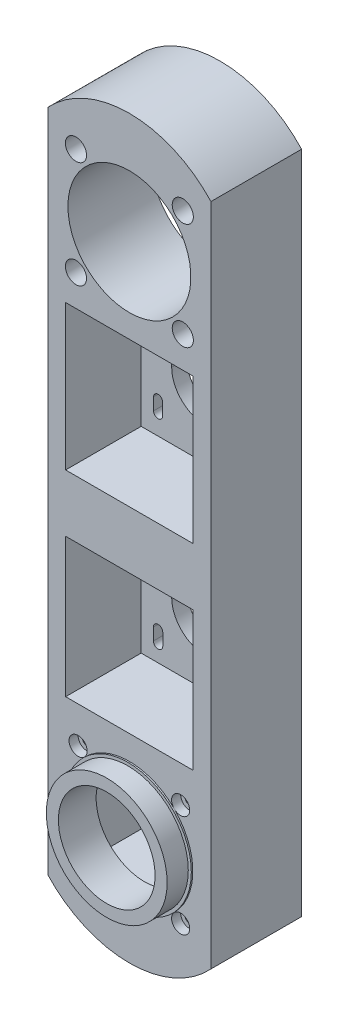
from build123d import *

# Parameters (mm, degrees)
SKETCH_1_W                = 54
SKETCH_1_H                = 220
EXTRUDE_1_DEPTH           = 30
SKETCH_2_W                = 42.2
SKETCH_2_H                = 48
CUT_EXTRUDE_1_DEPTH       = 25
SKETCH_3_W                = 42.2
SKETCH_3_H                = 46
CUT_EXTRUDE_2_DEPTH       = 25
CUT_EXTRUDE_3_DEPTH       = 116.99137899
CUT_EXTRUDE_13_DEPTH      = 116.99137899
SKETCH_18_W               = 42
SKETCH_18_H               = 42.7
CUT_EXTRUDE_9_DEPTH       = 25
SKETCH_9_R                = 16
SKETCH_9_R_2              = 1.55
CUT_EXTRUDE_4_DEPTH       = 116.99137899
SKETCH_16_W               = 42.7
SKETCH_16_H               = 42.7
CUT_EXTRUDE_7_DEPTH       = 2.5
SKETCH_13_R               = 20.35
SKETCH_13_R_2             = 2.05
CUT_EXTRUDE_6_DEPTH       = 117.555780637
EXTRUDE_3_DEPTH           = 30
SKETCH_17_R               = 2.05
CUT_EXTRUDE_8_DEPTH       = 8
CUT_EXTRUDE_11_DEPTH      = 129.309959191
CUT_EXTRUDE_11_DEPTH_BACK = 7.5
SKETCH_21_R               = 3.5
EXTRUDE_4_DEPTH           = 30
SKETCH_29_R               = 3
CUT_EXTRUDE_15_DEPTH      = 3
SKETCH_30_R               = 2.05
CUT_EXTRUDE_16_DEPTH      = 8
SKETCH_33_R               = 20
SKETCH_33_R_2             = 16
EXTRUDE_7_DEPTH           = 7.5
SKETCH_34_R               = 21
SKETCH_34_R_2             = 20
EXTRUDE_8_DEPTH           = 0.5


with BuildPart() as part:
    # 草图1 → 凸台-拉伸1 (new body)
    with BuildSketch(Plane.XY):
        Rectangle(SKETCH_1_W, SKETCH_1_H)
    extrude(amount=EXTRUDE_1_DEPTH)

    # 草图2 → 切除-拉伸1 (cut)
    with BuildSketch(Plane.XY.offset(30)):
        with Locations((0, 33)):
            Rectangle(SKETCH_2_W, SKETCH_2_H)
    extrude(amount=-CUT_EXTRUDE_1_DEPTH, mode=Mode.SUBTRACT)

    # 草图3 → 切除-拉伸2 (cut)
    with BuildSketch(Plane(origin=(0, 0, 30), x_dir=(-1, 0, 0), z_dir=(0, 0, -1))):
        with Locations((0, -33)):
            Rectangle(SKETCH_3_W, SKETCH_3_H)
    extrude(amount=CUT_EXTRUDE_2_DEPTH, mode=Mode.SUBTRACT)

    # 草图4 → 切除-拉伸3 (cut, through all)
    with BuildSketch(Plane.XY.offset(5)):
        with BuildLine():
            Line((11, 31), (11, 35))
            ThreePointArc((11, 35), (0, 46), (-11, 35))
            Line((-11, 35), (-11, 31))
            ThreePointArc((-11, 31), (0, 20), (11, 31))
        make_face()
        with BuildLine():
            Line((-14, 46.5), (-14, 50.5))
            ThreePointArc((-14, 50.5), (-15.5, 52), (-17, 50.5))
            Line((-17, 50.5), (-17, 46.5))
            ThreePointArc((-17, 46.5), (-15.5, 45), (-14, 46.5))
        make_face()
        with BuildLine():
            ThreePointArc((17, 50.5), (15.5, 52), (14, 50.5))
            Line((14, 50.5), (14, 46.5))
            ThreePointArc((14, 46.5), (15.5, 45), (17, 46.5))
            Line((17, 46.5), (17, 50.5))
        make_face()
        with BuildLine():
            Line((14, 19.5), (14, 15.5))
            ThreePointArc((14, 15.5), (15.5, 14), (17, 15.5))
            Line((17, 15.5), (17, 19.5))
            ThreePointArc((17, 19.5), (15.5, 21), (14, 19.5))
        make_face()
        with BuildLine():
            ThreePointArc((-17, 15.5), (-15.5, 14), (-14, 15.5))
            Line((-14, 15.5), (-14, 19.5))
            ThreePointArc((-14, 19.5), (-15.5, 21), (-17, 19.5))
            Line((-17, 19.5), (-17, 15.5))
        make_face()
    extrude(amount=-CUT_EXTRUDE_3_DEPTH, mode=Mode.SUBTRACT)

    # 草图26 → 切除-拉伸13 (cut, through all)
    with BuildSketch(Plane.XY.offset(5)):
        with BuildLine():
            Line((11, -31), (11, -35))
            ThreePointArc((11, -35), (0, -46), (-11, -35))
            Line((-11, -35), (-11, -31))
            ThreePointArc((-11, -31), (0, -20), (11, -31))
        make_face()
        with BuildLine():
            Line((-13.95, -15.5), (-13.95, -19.5))
            ThreePointArc((-13.95, -19.5), (-15.5, -21.05), (-17.05, -19.5))
            Line((-17.05, -19.5), (-17.05, -15.5))
            ThreePointArc((-17.05, -15.5), (-15.5, -13.95), (-13.95, -15.5))
        make_face()
        with BuildLine():
            Line((-13.95, -50.5), (-13.95, -46.5))
            ThreePointArc((-13.95, -46.5), (-15.5, -44.95), (-17.05, -46.5))
            Line((-17.05, -46.5), (-17.05, -50.5))
            ThreePointArc((-17.05, -50.5), (-15.5, -52.05), (-13.95, -50.5))
        make_face()
        with BuildLine():
            Line((13.95, -50.5), (13.95, -46.5))
            ThreePointArc((13.95, -46.5), (15.5, -44.95), (17.05, -46.5))
            Line((17.05, -46.5), (17.05, -50.5))
            ThreePointArc((17.05, -50.5), (15.5, -52.05), (13.95, -50.5))
        make_face()
        with BuildLine():
            Line((13.95, -15.5), (13.95, -19.5))
            ThreePointArc((13.95, -19.5), (15.5, -21.05), (17.05, -19.5))
            Line((17.05, -19.5), (17.05, -15.5))
            ThreePointArc((17.05, -15.5), (15.5, -13.95), (13.95, -15.5))
        make_face()
    extrude(amount=-CUT_EXTRUDE_13_DEPTH, mode=Mode.SUBTRACT)

    # 草图18 → 切除-拉伸9 (cut)
    with BuildSketch(Plane.XY):
        with Locations((0, -85)):
            Rectangle(SKETCH_18_W, SKETCH_18_H)
    extrude(amount=CUT_EXTRUDE_9_DEPTH, mode=Mode.SUBTRACT)

    # 草图9 → 切除-拉伸4 (cut, through all)
    with BuildSketch(Plane.XY.offset(25)):
        with Locations((0, -85)):
            Circle(SKETCH_9_R)
        with Locations((-16.970562748, -68.029437252)):
            Circle(SKETCH_9_R_2)
        with Locations((16.970562748, -68.029437252)):
            Circle(SKETCH_9_R_2)
        with Locations((16.970562748, -101.970562748)):
            Circle(SKETCH_9_R_2)
        with Locations((-16.970562748, -101.970562748)):
            Circle(SKETCH_9_R_2)
    extrude(amount=CUT_EXTRUDE_4_DEPTH, mode=Mode.SUBTRACT)

    # 草图16 → 切除-拉伸7 (cut)
    with BuildSketch(Plane.XY):
        with Locations((0, 85)):
            Rectangle(SKETCH_16_W, SKETCH_16_H)
    extrude(amount=CUT_EXTRUDE_7_DEPTH, mode=Mode.SUBTRACT)

    # 草图13 → 切除-拉伸6 (cut, through all)
    with BuildSketch(Plane(origin=(0, 0, 2.5), x_dir=(-1, 0, 0), z_dir=(0, 0, -1))):
        with Locations((0, 85)):
            Circle(SKETCH_13_R)
        with Locations((-17.67766953, 102.67766953)):
            Circle(SKETCH_13_R_2)
        with Locations((17.67766953, 102.67766953)):
            Circle(SKETCH_13_R_2)
        with Locations((17.67766953, 67.32233047)):
            Circle(SKETCH_13_R_2)
        with Locations((-17.67766953, 67.32233047)):
            Circle(SKETCH_13_R_2)
    extrude(amount=-CUT_EXTRUDE_6_DEPTH, mode=Mode.SUBTRACT)

    # 草图15 → 凸台-拉伸3 (add)
    with BuildSketch(Plane(origin=(0, 0, 0), x_dir=(-1, 0, 0), z_dir=(0, 0, -1))):
        with BuildLine():
            Line((-27, 110), (27, 110))
            ThreePointArc((27, 110), (0, 121.796738986), (-27, 110))
        make_face()
    extrude(amount=-EXTRUDE_3_DEPTH)

    # 草图17 → 切除-拉伸8 (cut)
    with BuildSketch(Plane(origin=(0, 0, 0), x_dir=(-1, 0, 0), z_dir=(0, 0, -1))):
        with Locations((-24, 100)):
            Circle(SKETCH_17_R)
        with Locations((24, 100)):
            Circle(SKETCH_17_R)
        with Locations((24, 66)):
            Circle(SKETCH_17_R)
        with Locations((-24, 66)):
            Circle(SKETCH_17_R)
    extrude(amount=-CUT_EXTRUDE_8_DEPTH, mode=Mode.SUBTRACT)

    # 草图21 → 切除-拉伸11 (cut, two sides: drawn at the far end of the back side and taken through both)
    with BuildSketch(Plane.XY.offset(30).offset(-CUT_EXTRUDE_11_DEPTH_BACK)):
        with Locations(Location((-17.67766953, 102.67766953, 0), (0, 0, 180))):
            Circle(SKETCH_21_R)
        with Locations(Location((17.67766953, 102.67766953, 0), (0, 0, 180))):
            Circle(SKETCH_21_R)
        with Locations(Location((17.67766953, 67.32233047, 0), (0, 0, 180))):
            Circle(SKETCH_21_R)
        with Locations(Location((-17.67766953, 67.32233047, 0), (0, 0, 180))):
            Circle(SKETCH_21_R)
    extrude(amount=CUT_EXTRUDE_11_DEPTH + CUT_EXTRUDE_11_DEPTH_BACK, mode=Mode.SUBTRACT)

    # 草图28 → 凸台-拉伸4 (add)
    with BuildSketch(Plane.XY.offset(30)):
        with BuildLine():
            Line((-27, -110), (27, -110))
            ThreePointArc((27, -110), (0, -121.795200461), (-27, -110))
        make_face()
    extrude(amount=-EXTRUDE_4_DEPTH)

    # 草图29 → 切除-拉伸15 (cut)
    with BuildSketch(Plane.XY.offset(30)):
        with Locations((-16.970562748, -68.029437252)):
            Circle(SKETCH_29_R)
        with Locations((16.970562748, -68.029437252)):
            Circle(SKETCH_29_R)
        with Locations((16.970562748, -101.970562748)):
            Circle(SKETCH_29_R)
        with Locations((-16.970562748, -101.970562748)):
            Circle(SKETCH_29_R)
    extrude(amount=-CUT_EXTRUDE_15_DEPTH, mode=Mode.SUBTRACT)

    # 草图30 → 切除-拉伸16 (cut)
    with BuildSketch(Plane(origin=(0, 0, 0), x_dir=(-1, 0, 0), z_dir=(0, 0, -1))):
        with Locations((-24, -100)):
            Circle(SKETCH_30_R)
        with Locations((-24, -66)):
            Circle(SKETCH_30_R)
        with Locations((24, -66)):
            Circle(SKETCH_30_R)
        with Locations((24, -100)):
            Circle(SKETCH_30_R)
    extrude(amount=-CUT_EXTRUDE_16_DEPTH, mode=Mode.SUBTRACT)

    # 草图33 → 凸台-拉伸7 (add)
    with BuildSketch(Plane.XY.offset(30)):
        with Locations((0, -85)):
            Circle(SKETCH_33_R)
        with Locations((0, -85)):
            Circle(SKETCH_33_R_2, mode=Mode.SUBTRACT)
    extrude(amount=EXTRUDE_7_DEPTH)

    # 草图34 → 凸台-拉伸8 (add)
    with BuildSketch(Plane.XY.offset(30)):
        with Locations(Location((0, -85, 0), (0, 0, 224.999937448))):
            Circle(SKETCH_34_R)
        with Locations((0, -85)):
            Circle(SKETCH_34_R_2, mode=Mode.SUBTRACT)
    extrude(amount=EXTRUDE_8_DEPTH)


solid = part.part
